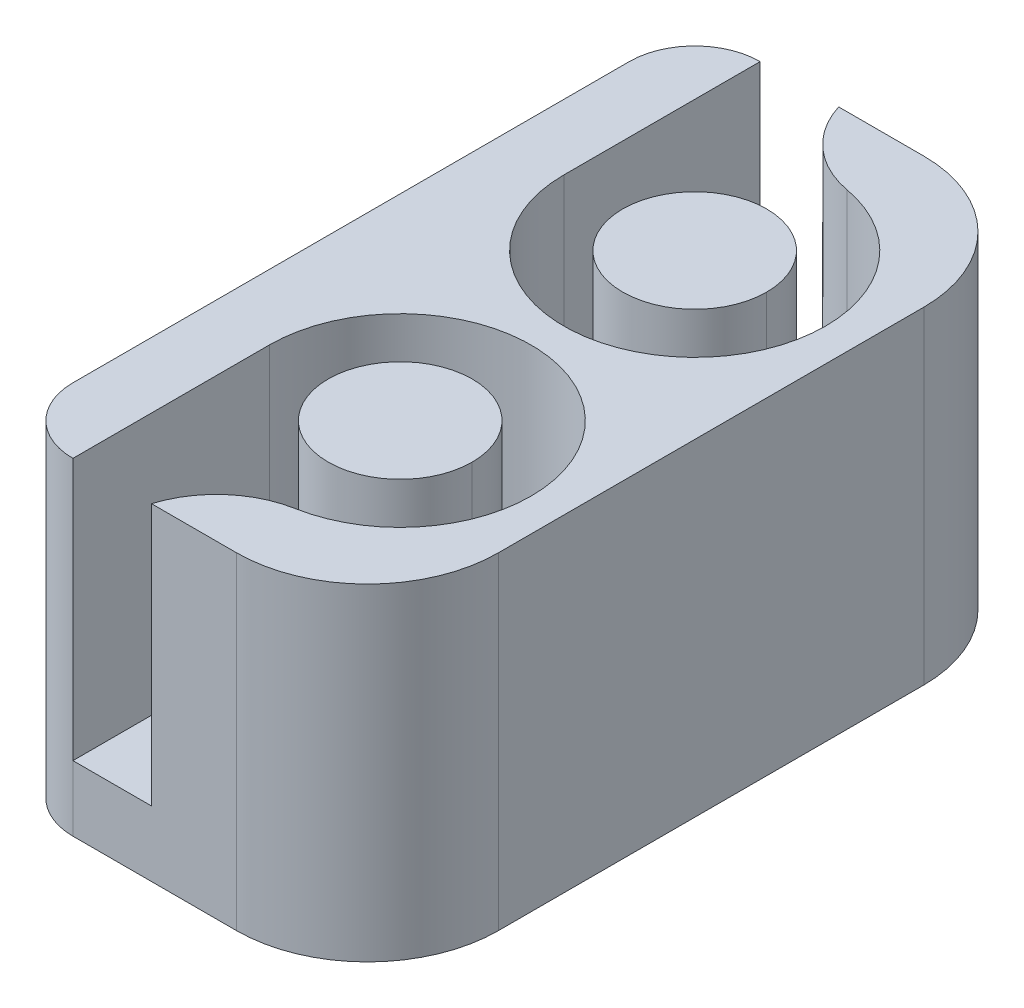
from build123d import *

# Parameters (mm, degrees)
BOSS_EXTRUDE3_DEPTH   = 8
BOSS_EXTRUDE3_2_DEPTH = 8
SKETCH4_W             = 11
SKETCH4_H             = 10.5
BOSS_EXTRUDE4_DEPTH   = 2
FILLET3_R             = 3
MIRROR2_START         = -2
MIRROR2_DEPTH         = 10
MIRROR2_2_DEPTH       = 2
CHAMFER1_SIZE         = 2
FILLET4_R             = 4
FILLET5_R             = 2


# Read off the part's stored shape, not the designer's step: Mirror2
with BuildPart() as part:
    # Sketch3 → Boss-Extrude3 (new body)
    with BuildSketch(Plane(origin=(0, 0, 0), x_dir=(1, 0, 0), z_dir=(0, 1, 0))):
        with BuildLine():
            Line((-1.1, -5.25), (5.5, -5.25))
            Line((5.5, -5.25), (5.5, 5.25))
            Line((5.5, 5.25), (-5.5, 5.25))
            Line((-5.5, 5.25), (-5.5, -5.25))
            Line((-5.5, -5.25), (-3.5, -5.25))
            Line((-3.5, -5.25), (-3.5, 0.751))
            ThreePointArc((-3.5, 0.751), (0.5, 4.751), (4.5, 0.751))
            Line((4.5, 0.751), (4.5, 0.75))
            ThreePointArc((4.5, 0.75), (2.69089023, -2.596640106), (-1.1, -2.916060556))
            Line((-1.1, -2.916060556), (-1.1, -5.25))
        make_face()
    extrude(amount=BOSS_EXTRUDE3_DEPTH)



with BuildPart() as body_2:
    # Sketch3 → Boss-Extrude3 2 (new body)
    with BuildSketch(Plane(origin=(0, 0, 0), x_dir=(1, 0, 0), z_dir=(0, 1, 0))):
        with BuildLine():
            ThreePointArc((-1.7, 0.75), (0.5, -1.45), (2.7, 0.75))
            Line((2.7, 0.75), (2.7, 0.751))
            ThreePointArc((2.7, 0.751), (0.5, 2.951), (-1.7, 0.751))
            Line((-1.7, 0.751), (-1.7, 0.75))
        make_face()
    extrude(amount=BOSS_EXTRUDE3_2_DEPTH)


with BuildPart() as part_1:
    add(part.part)

    add(body_2.part)  # Boss-Extrude4 merges body 2
    # Sketch4 → Boss-Extrude4 (add)
    with BuildSketch(Plane(origin=(0, 0, 0), x_dir=(-1, 0, 0), z_dir=(0, -1, 0))):
        Rectangle(SKETCH4_W, SKETCH4_H)
    extrude(amount=BOSS_EXTRUDE4_DEPTH)

    # Fillet3
    # the kernel refuses this fillet: 3 mm, written as the material it takes off along each edge
    with BuildSketch(Plane(origin=(-1.1, 0, 2.916060556), x_dir=(1.3123233716119625e-12, 0, 1.0), z_dir=(0, 1, 0))) as fillet3_piece_1:
        with BuildLine():
            CenterArc((3.21838304, 2.866663483), FILLET3_R, 190.425211714, 62.42837206)
            ThreePointArc((0.267907213, 2.323807705), (0.307618872, 1.141882326), (0, 0))
            Line((0, 0), (2.333939444, 0))
        make_face()
    extrude(amount=13.847999938, mode=Mode.SUBTRACT)

    # Mirror2 outline → Mirror2 (add)
    with BuildSketch(Plane(origin=(0, 0, 0), x_dir=(1, 0, 0), z_dir=(0, 1, 0)).offset(MIRROR2_START)):
        with BuildLine():
            ThreePointArc((1.223807705, 13.683967769), (3.573697352, 12.309762604), (4.5, 9.75))
            Line((4.5, 9.75), (4.5, 9.749))
            ThreePointArc((4.5, 9.749), (0.5, 5.749), (-3.5, 9.749))
            Line((-3.5, 9.749), (-3.5, 15.75))
            Line((-3.5, 15.75), (-5.5, 15.75))
            Line((-5.5, 15.75), (-5.5, 5.25))
            Line((-5.5, 5.25), (5.5, 5.25))
            Line((5.5, 5.25), (5.5, 15.75))
            Line((5.5, 15.75), (-1.1, 15.75))
            ThreePointArc((-1.1, 15.75), (-0.226657287, 14.392419442), (1.223807705, 13.683967769))
        make_face()
        with BuildLine():
            ThreePointArc((-1.7, 9.749), (0.5, 7.549), (2.7, 9.749))
            Line((2.7, 9.749), (2.7, 9.75))
            ThreePointArc((2.7, 9.75), (0.5, 11.95), (-1.7, 9.75))
            Line((-1.7, 9.75), (-1.7, 9.749))
        make_face()
    extrude(amount=MIRROR2_DEPTH)

    # Mirror2 2 outline → Mirror2 2 (add)
    with BuildSketch(Plane(origin=(0, 0, 0), x_dir=(1, 0, 0), z_dir=(0, 1, 0)).offset(MIRROR2_START)):
        with BuildLine():
            Line((4.5, 9.749), (4.5, 9.75))
            ThreePointArc((4.5, 9.75), (3.573697352, 12.309762604), (1.223807705, 13.683967769))
            ThreePointArc((1.223807705, 13.683967769), (-0.226657287, 14.392419442), (-1.1, 15.75))
            Line((-1.1, 15.75), (-3.5, 15.75))
            Line((-3.5, 15.75), (-3.5, 9.749))
            ThreePointArc((-3.5, 9.749), (0.5, 5.749), (4.5, 9.749))
        make_face()
        with BuildLine():
            Line((2.7, 9.75), (2.7, 9.749))
            ThreePointArc((2.7, 9.749), (0.5, 7.549), (-1.7, 9.749))
            Line((-1.7, 9.749), (-1.7, 9.75))
            ThreePointArc((-1.7, 9.75), (0.5, 11.95), (2.7, 9.75))
        make_face(mode=Mode.SUBTRACT)
    extrude(amount=MIRROR2_2_DEPTH)

    # Chamfer1
    # the kernel refuses this chamfer: 2 mm, written as the material it adds along each edge
    with BuildSketch(Plane(origin=(0.5, 0, -9.749), x_dir=(1, 0, 0), z_dir=(0, 0, -1))) as chamfer1_piece_1:
        Polygon((2.2 + CHAMFER1_SIZE, 0), (2.2, -CHAMFER1_SIZE), (2.2, 0), align=None)
    revolve(axis=Axis((0.5, 0, -9.749), (0, -1, 0)), revolution_arc=180)
    with BuildSketch(Plane(origin=(-1.7, 0, -9.749), x_dir=(-0.9996219169112968, -0.027495876610586365, 0), z_dir=(0, 0, -1)), Plane(origin=(2.7, 0, -9.75), x_dir=(0.9996219169112968, -0.027495876610586365, 0), z_dir=(0, 0, 1))) as chamfer1_piece_2:
        Polygon((CHAMFER1_SIZE * 0.999621916911, CHAMFER1_SIZE * 0.0274958766106), (-CHAMFER1_SIZE * 0.0274958766106, CHAMFER1_SIZE * 0.999621916911), (0, 0), align=None)
    extrude(amount=0.001)
    with BuildSketch(Plane(origin=(0.5, 0, -9.75), x_dir=(-1, 0, 0), z_dir=(0, 0, 1))) as chamfer1_piece_3:
        Polygon((2.2 + CHAMFER1_SIZE, 0), (2.2, -CHAMFER1_SIZE), (2.2, 0), align=None)
    revolve(axis=Axis((0.5, 0, -9.75), (0, -1, 0)), revolution_arc=180)
    with BuildSketch(Plane(origin=(0.5, 0, -0.751), x_dir=(1, 0, 0), z_dir=(0, 0, 1))) as chamfer1_piece_4:
        Polygon((2.2 + CHAMFER1_SIZE, 0), (2.2, CHAMFER1_SIZE), (2.2, 0), align=None)
    revolve(axis=Axis((0.5, 0, -0.751), (0, 1, 0)), revolution_arc=180)
    with BuildSketch(Plane(origin=(-1.7, 0, -0.751), x_dir=(-0.9996219169112968, -0.027495876610586372, 0), z_dir=(0, 0, 1)), Plane(origin=(2.7, 0, -0.75), x_dir=(0.9996219169112968, -0.027495876610586358, 0), z_dir=(0, 0, -1))) as chamfer1_piece_5:
        Polygon((CHAMFER1_SIZE * 0.999621916911, -CHAMFER1_SIZE * 0.0274958766106), (-CHAMFER1_SIZE * 0.0274958766106, -CHAMFER1_SIZE * 0.999621916911), (0, 0), align=None)
    extrude(amount=0.001)
    with BuildSketch(Plane(origin=(0.5, 0, -0.75), x_dir=(-1, 0, 0), z_dir=(0, 0, -1))) as chamfer1_piece_6:
        Polygon((2.2 + CHAMFER1_SIZE, 0), (2.2, CHAMFER1_SIZE), (2.2, 0), align=None)
    revolve(axis=Axis((0.5, 0, -0.75), (0, 1, 0)), revolution_arc=180)

    # Fillet4
    fillet4_edges = [part_1.edges().sort_by_distance(p)[0] for p in [
        (5.5, 3, 5.25),
        (5.5, 3, -15.75),
    ]]
    fillet(fillet4_edges, radius=FILLET4_R)

    # Fillet5
    fillet5_edges = [part_1.edges().sort_by_distance(p)[0] for p in [
        (-5.5, 3, -15.75),
        (-5.5, 3, 5.25),
    ]]
    fillet(fillet5_edges, radius=FILLET5_R)


solid = part_1.part
